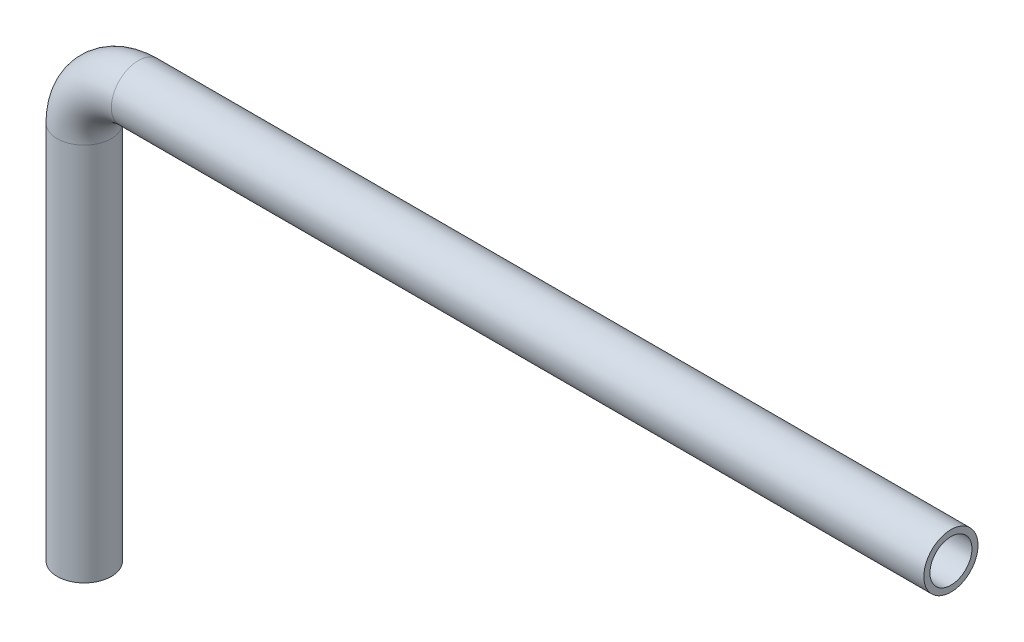
from build123d import *

# Parameters (mm, degrees)
SKETCH1_R   = 1.5875
SKETCH1_R_2 = 1.2319


with BuildPart() as part:
    # Sweep1: sweep along a path in Sketch2
    with BuildLine(Plane.XY) as sweep1_path:
        Line((0, 0), (0, 22.225))
        ThreePointArc((0, 22.225), (0.92993597, 24.47006403), (3.175, 25.4))
        Line((3.175, 25.4), (50.8, 25.4))
    # Sketch1 → Sweep1 (sweep)
    with BuildSketch(Plane(origin=(0, 0, 0), x_dir=(1, 0, 0), z_dir=(0, 1, 0))):
        Circle(SKETCH1_R)
        Circle(SKETCH1_R_2, mode=Mode.SUBTRACT)
    sweep(path=sweep1_path.line)


solid = part.part
